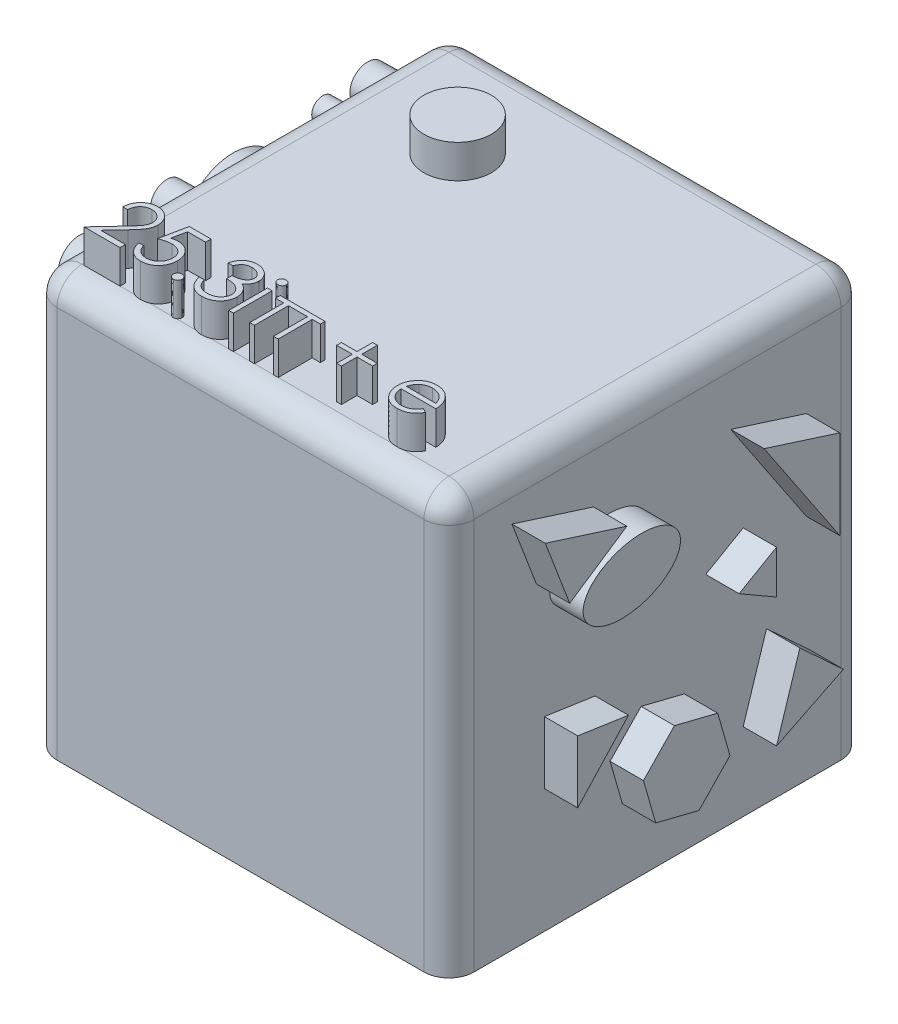
from build123d import *

# Parameters (mm, degrees)
SKETCH1_W            = 25
SKETCH1_H            = 25
BOSS_EXTRUDE1_DEPTH  = 25
FILLET1_R            = 1.5
SKETCH6_R            = 2.026123186
BOSS_EXTRUDE5_DEPTH  = 2
SKETCH7_R            = 3.595459334
SKETCH7_R_2          = 0.715535939
SKETCH7_R_3          = 2.059834248
SKETCH7_R_4          = 1.586063715
SKETCH7_R_5          = 2.397187079
SKETCH7_R_6          = 3.627701662
BOSS_EXTRUDE6_DEPTH  = 2
SKETCH8_R            = 1.764622128
SKETCH8_R_2          = 3.10645752
SKETCH8_R_3          = 0.547583735
SKETCH8_R_4          = 1.250736535
SKETCH8_R_5          = 1.052033482
SKETCH8_R_6          = 0.451602651
SKETCH8_R_7          = 1.617873899
SKETCH8_R_8          = 1.022441615
SKETCH8_R_9          = 0.77507926
SKETCH8_R_10         = 1.237307576
SKETCH8_R_11         = 1.5191319
SKETCH8_R_12         = 1.217510418
SKETCH8_R_13         = 1.369527197
SKETCH8_R_14         = 0.830021689
SKETCH8_R_15         = 1.879951284
SKETCH8_R_16         = 1.537232229
SKETCH8_R_17         = 1.151365365
SKETCH8_R_18         = 1.459956672
SKETCH8_R_19         = 1.790115864
SKETCH8_R_20         = 1.38656203
SKETCH8_R_21         = 1.341895942
SKETCH8_R_22         = 1.023270854
SKETCH8_R_23         = 1.246779248
SKETCH8_R_24         = 1.104587198
SKETCH8_R_25         = 0.55757663
SKETCH8_R_26         = 0.268564469
SKETCH8_R_27         = 0.690422027
SKETCH8_R_28         = 0.887930936
SKETCH8_R_29         = 1.067289644
SKETCH8_R_30         = 0.598454039
SKETCH8_R_31         = 1.309058838
SKETCH8_R_32         = 0.698196379
SKETCH8_R_33         = 0.775813334
SKETCH8_R_34         = 0.897681058
SKETCH8_R_35         = 0.98361322
SKETCH8_R_36         = 0.459674454
SKETCH8_R_37         = 0.884806863
SKETCH8_R_38         = 0.811843828
BOSS_EXTRUDE8_DEPTH  = 2
BOSS_EXTRUDE8_TAPER  = 1
SKETCH9_RX           = 2.964294683
SKETCH9_RY           = 1.852579298
BOSS_EXTRUDE9_DEPTH  = 2
BOSS_EXTRUDE10_DEPTH = 2
SKETCH11_W           = 0.284935898
SKETCH11_H           = 2.320192308
BOSS_EXTRUDE11_DEPTH = 2


with BuildPart() as part:
    # Sketch1 → Boss-Extrude1 (new body)
    with BuildSketch(Plane(origin=(0, 0, 0), x_dir=(1, 0, 0), z_dir=(0, 1, 0))):
        with Locations((12.5, -12.5)):
            Rectangle(SKETCH1_W, SKETCH1_H)
    extrude(amount=BOSS_EXTRUDE1_DEPTH)

    # Fillet1
    fillet1_edges = [part.edges().sort_by_distance(p)[0] for p in [
        (0, 12.5, 25),
        (0, 12.5, 0),
        (25, 12.5, 0),
        (25, 12.5, 25),
        (0, 25, 12.5),
        (12.5, 25, 0),
        (12.5, 25, 25),
        (25, 25, 12.5),
    ]]
    fillet(fillet1_edges, radius=FILLET1_R)

    # Sketch6 → Boss-Extrude5 (add)
    with BuildSketch(Plane(origin=(0, 25, 0), x_dir=(1, 0, 0), z_dir=(0, 1, 0))):
        with Locations((6.996974354, -6.4810657)):
            Circle(SKETCH6_R)
    extrude(amount=BOSS_EXTRUDE5_DEPTH)

    # Sketch7 → Boss-Extrude6 (add)
    with BuildSketch(Plane(origin=(0, 0, 0), x_dir=(-1, 0, 0), z_dir=(0, -1, 0))):
        with Locations((-5.965157046, -19.12082773)):
            Circle(SKETCH7_R)
        with Locations((-15.810413865, -15.079543271)):
            Circle(SKETCH7_R_2)
        with Locations((-16.525949804, -19.550751609)):
            Circle(SKETCH7_R_3)
        with Locations((-7.942806887, -9.361555686)):
            Circle(SKETCH7_R_4)
        with Locations((-17.143177889, -9.748487177)):
            Circle(SKETCH7_R_5)
        with Locations((-11.769129406, -4.890347349)):
            Circle(SKETCH7_R_6)
    extrude(amount=BOSS_EXTRUDE6_DEPTH)

    # Sketch8 → Boss-Extrude8 (add)
    with BuildSketch(Plane.ZY):
        with Locations((5.567907382, 18.58428273)):
            Circle(SKETCH8_R)
        with Locations((10.953993733, 19.681448468)):
            Circle(SKETCH8_R_2)
        with Locations((7.847536212, 13.647036908)):
            Circle(SKETCH8_R_3)
        with Locations((14.060451253, 14.694331476)):
            Circle(SKETCH8_R_4)
        with Locations((17.636730501, 19.132865599)):
            Circle(SKETCH8_R_5)
        with Locations((10.156055014, 9.657343315)):
            Circle(SKETCH8_R_6)
        with Locations((3.803285254, 11.053736072)):
            Circle(SKETCH8_R_7)
        with Locations((7.299952477, 11.402834262)):
            Circle(SKETCH8_R_8)
        with Locations((15.311187788, 10.108945966)):
            Circle(SKETCH8_R_9)
        with Locations((10.607657665, 13.099453173)):
            Circle(SKETCH8_R_10)
        with Locations((17.237761142, 13.443594941)):
            Circle(SKETCH8_R_11)
        with Locations((5.867134401, 7.163784819)):
            Circle(SKETCH8_R_12)
        with Locations((10.607657665, 6.71494429)):
            Circle(SKETCH8_R_13)
        with Locations((15.741626045, 7.163784819)):
            Circle(SKETCH8_R_14)
        with Locations((3.803285254, 2.874864206)):
            Circle(SKETCH8_R_15)
        with Locations((9.238130468, 2.874864206)):
            Circle(SKETCH8_R_16)
        with Locations((14.911604356, 3.672802925)):
            Circle(SKETCH8_R_17)
        with Locations((19.232607939, 4.82416829)):
            Circle(SKETCH8_R_18)
        with Locations((19.731319638, 10.108945966)):
            Circle(SKETCH8_R_19)
        with Locations((20.130288997, 16.988405292)):
            Circle(SKETCH8_R_20)
        with Locations((20.130288997, 21.776037604)):
            Circle(SKETCH8_R_21)
        with Locations((14.911604356, 22.374491643)):
            Circle(SKETCH8_R_22)
        with Locations((2.874864206, 15.542141365)):
            Circle(SKETCH8_R_23)
        with Locations((2.874864206, 22.374491643)):
            Circle(SKETCH8_R_24)
        with Locations((6.266103761, 16.090724234)):
            Circle(SKETCH8_R_25)
        with Locations((4.769968663, 14.295362117)):
            Circle(SKETCH8_R_26)
        with Locations((9.238130468, 16.090724234)):
            Circle(SKETCH8_R_27)
        with Locations((2.326281337, 7.861981198)):
            Circle(SKETCH8_R_28)
        with Locations((17.237761142, 2.326281337)):
            Circle(SKETCH8_R_29)
        with Locations((20.130288997, 2.326281337)):
            Circle(SKETCH8_R_30)
        with Locations((21.127712395, 7.163784819)):
            Circle(SKETCH8_R_14)
        with Locations((12.30051532, 10.654766713)):
            Circle(SKETCH8_R_31)
        with Locations((5.567907382, 22.374491643)):
            Circle(SKETCH8_R_32)
        with Locations((2.326281337, 19.132865599)):
            Circle(SKETCH8_R_33)
        with Locations((21.127712395, 13.443594941)):
            Circle(SKETCH8_R_34)
        with Locations((15.741626045, 16.988405292)):
            Circle(SKETCH8_R_35)
        with Locations((14.911604356, 19.908678932)):
            Circle(SKETCH8_R_36)
        with Locations((13.297938719, 7.163784819)):
            Circle(SKETCH8_R_37)
        with Locations((12.30051532, 1.927311978)):
            Circle(SKETCH8_R_38)
    extrude(amount=BOSS_EXTRUDE8_DEPTH, taper=BOSS_EXTRUDE8_TAPER)

    # Sketch9 → Boss-Extrude9 (add)
    with BuildSketch(Plane(origin=(25, 0, 0), x_dir=(0, 0, -1), z_dir=(1, 0, 0))):
        with Locations(Location((-16.040853064, 17.836215181), (0, 0, -167.366638065))):
            Ellipse(SKETCH9_RX, SKETCH9_RY)
        Polygon((-10.156055014, 5.567907382), (-10.891239331, 8.137934389), (-13.484540167, 8.786259598), (-15.342656685, 6.8645578), (-14.607472368, 4.294530792), (-12.014171533, 3.646205583), align=None)
    extrude(amount=BOSS_EXTRUDE9_DEPTH)

    # Sketch10 → Boss-Extrude10 (add)
    with BuildSketch(Plane(origin=(25, 0, 0), x_dir=(0, 0, -1), z_dir=(1, 0, 0))):
        Polygon((-19.282479109, 7.413140669), (-19.282479109, 11.153478412), (-16.240337744, 10.704637883), align=None)
        Polygon((-9.607472145, 13.696908078), (-7.363269499, 12.401217076), (-7.363269499, 14.99259908), align=None)
        Polygon((-8.111337047, 20.479387187), (-3.573060585, 19.033123259), (-3.573060585, 13.696908078), align=None)
        Polygon((-7.363269499, 4.670226323), (-5.964684602, 9.058889276), (-3.355326895, 6.647210183), align=None)
        Polygon((-21.227454735, 22.125135794), (-16.339359303, 20.567391095), (-19.761296972, 18.277712214), align=None)
    extrude(amount=BOSS_EXTRUDE10_DEPTH)

    # Sketch11 → Boss-Extrude11 (add)
    # profile 1 of 9: a face of its own
    with BuildSketch(Plane(origin=(0, 25, 0), x_dir=(1, 0, 0), z_dir=(0, 1, 0))):
        with BuildLine():
            Line((2.029166667, -21.301923077), (1.744230769, -21.301923077))
            add(Edge.make_bspline(
                [(1.744230769, -21.301923077), (1.746087829, -21.264121629), (1.749735046, -21.189880591), (1.766814994, -21.081636761), (1.791254219, -20.978172765), (1.825808609, -20.880319343), (1.868722161, -20.787211282), (1.9201844, -20.699218411), (1.981138822, -20.616676404), (2.050269216, -20.540350453), (2.125352196, -20.4703303), (2.206365441, -20.409864472), (2.291496287, -20.358776299), (2.380486456, -20.316066887), (2.474339968, -20.284008598), (2.572205131, -20.260221825), (2.674511919, -20.245910426), (2.744216797, -20.244372106), (2.779667468, -20.243589744)],
                knots=[0, 0, 0, 0, 1.10065271, 2.161652631, 3.183658789, 4.190468796, 5.17591951, 6.163126047, 7.15150782, 8.156236427, 9.156009102, 10.134482811, 11.092018607, 12.041330605, 13.001268258, 13.972401359, 14.968799086, 16, 16, 16, 16], degree=3))
            add(Edge.make_bspline(
                [(2.779667468, -20.243589744), (2.814481864, -20.244404772), (2.882890908, -20.246006274), (2.982732878, -20.259759493), (3.077780852, -20.281300137), (3.167849041, -20.311521979), (3.252218828, -20.352147852), (3.331524018, -20.400949905), (3.406708754, -20.457392181), (3.474387764, -20.523843854), (3.536534379, -20.594784589), (3.590148568, -20.670520044), (3.636061937, -20.748742325), (3.67433219, -20.830047908), (3.702504545, -20.915202341), (3.723893348, -21.002965875), (3.735983216, -21.094246953), (3.737838707, -21.156029329), (3.738782051, -21.187439904)],
                knots=[0, 0, 0, 0, 1.111607364, 2.184268762, 3.212621178, 4.221274766, 5.211760367, 6.196651075, 7.1921475, 8.207485113, 9.220403448, 10.201281604, 11.166441695, 12.114753415, 13.065576456, 14.026450734, 14.996634279, 16, 16, 16, 16], degree=3))
            add(Edge.make_bspline(
                [(3.738782051, -21.187439904), (3.73724602, -21.231661154), (3.734200913, -21.319327633), (3.708152871, -21.448155402), (3.667470679, -21.572972289), (3.618487362, -21.673426842), (3.569073074, -21.754374368), (3.524543692, -21.821020979), (3.472414899, -21.89278094), (3.411927976, -21.969413953), (3.344334156, -22.051520274), (3.269021194, -22.139050303), (3.185452035, -22.231099694), (3.126797538, -22.293969775), (3.096404247, -22.326547476)],
                knots=[0, 0, 0, 0, 1.184426356, 2.348067706, 3.509069118, 4.696110526, 5.333549288, 6.050745305, 6.844228056, 7.710549037, 8.667450064, 9.695053472, 10.805634456, 12, 12, 12, 12], degree=3))
            Line((3.096404247, -22.326547476), (2.302018229, -23.174358974))
            Line((2.302018229, -23.174358974), (3.779487179, -23.174358974))
            Line((3.779487179, -23.174358974), (3.779487179, -23.5))
            Line((3.779487179, -23.5), (1.622115385, -23.5))
            Line((1.622115385, -23.5), (2.853445513, -22.18598758))
            add(Edge.make_bspline(
                [(2.853445513, -22.18598758), (2.883424667, -22.154692688), (2.941008488, -22.094581604), (3.022454111, -22.006821919), (3.095605193, -21.925406264), (3.160935257, -21.850488467), (3.217027079, -21.780972687), (3.266804033, -21.719110349), (3.306687104, -21.662183098), (3.349971785, -21.596196969), (3.391894468, -21.51563151), (3.427919248, -21.417175949), (3.449885575, -21.31582337), (3.452520676, -21.247332236), (3.453846154, -21.212880609)],
                knots=[0, 0, 0, 0, 1.329631726, 2.553950428, 3.673215718, 4.687767853, 5.603093632, 6.413772471, 7.123043292, 7.734684054, 8.834405432, 9.900288307, 10.943827018, 12, 12, 12, 12], degree=3))
            add(Edge.make_bspline(
                [(3.453846154, -21.212880609), (3.453269445, -21.191216769), (3.452132862, -21.1485215), (3.442101951, -21.085923419), (3.426943134, -21.025539624), (3.405221365, -20.967184376), (3.376549536, -20.911444392), (3.341648684, -20.858251821), (3.301380555, -20.806826831), (3.254797618, -20.758609196), (3.203624311, -20.714448388), (3.149563813, -20.675328682), (3.092368361, -20.64263606), (3.032279108, -20.615835888), (2.969463575, -20.594812506), (2.90380027, -20.580245081), (2.835470627, -20.571098827), (2.788813099, -20.569861329), (2.765039063, -20.569230769)],
                knots=[0, 0, 0, 0, 0.991446411, 1.95395049, 2.89581595, 3.838931463, 4.798493298, 5.75982156, 6.748411868, 7.785213223, 8.824556874, 9.840280684, 10.836137867, 11.835679398, 12.848801643, 13.863922112, 14.911575587, 16, 16, 16, 16], degree=3))
            add(Edge.make_bspline(
                [(2.765039063, -20.569230769), (2.740209807, -20.569879406), (2.691449249, -20.57115322), (2.619858412, -20.58006378), (2.551563457, -20.595436078), (2.486392588, -20.616460633), (2.424235535, -20.643183745), (2.365394581, -20.676468399), (2.310001817, -20.716186282), (2.257953113, -20.761217358), (2.209997932, -20.811352968), (2.167863981, -20.867242006), (2.131048482, -20.927864018), (2.098927249, -20.993055432), (2.07284173, -21.063407789), (2.052908944, -21.13867135), (2.03713659, -21.218519318), (2.031867432, -21.273660073), (2.029166667, -21.301923077)],
                knots=[0, 0, 0, 0, 1.031018746, 2.02475058, 2.990194455, 3.934040569, 4.864654155, 5.795059489, 6.735614925, 7.690564532, 8.649604399, 9.611025574, 10.590972636, 11.591080095, 12.624614302, 13.701020113, 14.821632451, 16, 16, 16, 16], degree=3))
        make_face()
    # profile 2 of 9: a face of its own
    with BuildSketch(Plane(origin=(0, 25, 0), x_dir=(1, 0, 0), z_dir=(0, 1, 0))):
        with BuildLine():
            Line((6.058974359, -20.325), (6.058974359, -20.650641026))
            Line((6.058974359, -20.650641026), (4.979016426, -20.650641026))
            Line((4.979016426, -20.650641026), (4.807927684, -21.485732171))
            add(Edge.make_bspline(
                [(4.807927684, -21.485732171), (4.841542656, -21.476451853), (4.906666347, -21.458472705), (5.002787078, -21.438510328), (5.094038577, -21.426476675), (5.153252663, -21.424833557), (5.18190605, -21.424038462)],
                knots=[0, 0, 0, 0, 1.100273476, 2.13160584, 3.095893838, 4, 4, 4, 4], degree=3))
            add(Edge.make_bspline(
                [(5.18190605, -21.424038462), (5.217360585, -21.424805846), (5.28707306, -21.426314716), (5.389071247, -21.440803465), (5.486437515, -21.463608959), (5.578968236, -21.495468289), (5.666834593, -21.536207833), (5.749228167, -21.587098493), (5.827385702, -21.646546586), (5.899905055, -21.714895276), (5.965694963, -21.790117028), (6.023539825, -21.870995954), (6.072673032, -21.956746048), (6.11218886, -22.0481866), (6.14374322, -22.144306689), (6.164745387, -22.246117675), (6.178730544, -22.352659898), (6.180292995, -22.425507615), (6.181089744, -22.462655248)],
                knots=[0, 0, 0, 0, 1.052922333, 2.070308379, 3.05430497, 4.020497103, 4.973039431, 5.925935799, 6.892292201, 7.88610001, 8.88166317, 9.857072816, 10.836096531, 11.812156883, 12.81219415, 13.836441305, 14.89672472, 16, 16, 16, 16], degree=3))
            add(Edge.make_bspline(
                [(6.181089744, -22.462655248), (6.180486425, -22.488528977), (6.179287942, -22.539926773), (6.173193223, -22.616257583), (6.161458681, -22.690972439), (6.145703674, -22.764081252), (6.125254481, -22.835445611), (6.10049941, -22.905269782), (6.070204442, -22.973119176), (6.036974552, -23.039635784), (5.999558104, -23.103315858), (5.958030458, -23.162868868), (5.914156048, -23.21918818), (5.866947077, -23.271669781), (5.815964746, -23.319968804), (5.76182649, -23.364371888), (5.704964309, -23.405629952), (5.644498482, -23.442068243), (5.581776373, -23.475598925), (5.515892204, -23.503106705), (5.448345712, -23.527699827), (5.378164718, -23.547302756), (5.305508188, -23.562663002), (5.230256356, -23.573095689), (5.152803891, -23.580694315), (5.100302986, -23.581169982), (5.073783053, -23.581410256)],
                knots=[0, 0, 0, 0, 1.056347294, 2.098418968, 3.122841568, 4.141288669, 5.149314143, 6.15115421, 7.162517403, 8.180376062, 9.185164535, 10.17417709, 11.141909838, 12.097768115, 13.052685741, 14.0056014, 14.954263652, 15.917497458, 16.885230207, 17.854509472, 18.828990115, 19.81800267, 20.826176721, 21.857883937, 22.917946725, 24, 24, 24, 24], degree=3))
            add(Edge.make_bspline(
                [(5.073783053, -23.581410256), (5.042147189, -23.580783568), (4.979907364, -23.579550632), (4.88872085, -23.566652434), (4.800986886, -23.548179453), (4.717411723, -23.52038798), (4.637246362, -23.485565219), (4.561570039, -23.441554121), (4.488449085, -23.39168022), (4.420856024, -23.332824471), (4.358121549, -23.268493817), (4.301963502, -23.198682242), (4.251949471, -23.124541962), (4.208880372, -23.045712923), (4.172142882, -22.962402255), (4.143282142, -22.874297819), (4.119988206, -22.781859958), (4.110133532, -22.718220702), (4.105128205, -22.685897436)],
                knots=[0, 0, 0, 0, 1.0467383, 2.05933395, 3.04377827, 4.011590433, 4.970194871, 5.932262533, 6.905835911, 7.896367577, 8.894135286, 9.877477877, 10.858688626, 11.851381753, 12.8477658, 13.868841284, 14.917554742, 16, 16, 16, 16], degree=3))
            Line((4.105128205, -22.685897436), (4.390064103, -22.685897436))
            add(Edge.make_bspline(
                [(4.390064103, -22.685897436), (4.397075008, -22.716174646), (4.410550358, -22.774369126), (4.44012843, -22.856131128), (4.476292474, -22.928992139), (4.51929499, -22.993915975), (4.570593947, -23.050529851), (4.629131357, -23.100982471), (4.694761078, -23.146498482), (4.767689221, -23.184437706), (4.844626801, -23.216794361), (4.925151341, -23.238340541), (5.007070284, -23.253490637), (5.062477091, -23.255007163), (5.090319511, -23.255769231)],
                knots=[0, 0, 0, 0, 1.136247022, 2.183929868, 3.172523383, 4.106158343, 5.02341133, 5.958108904, 6.928429099, 7.938127109, 8.96079061, 9.975095812, 10.982467395, 12, 12, 12, 12], degree=3))
            add(Edge.make_bspline(
                [(5.090319511, -23.255769231), (5.1174961, -23.255024668), (5.171007026, -23.253558618), (5.249757355, -23.242274657), (5.325787605, -23.224896003), (5.398347565, -23.198888349), (5.468706961, -23.167279211), (5.535086025, -23.12671625), (5.599405063, -23.080034661), (5.65966487, -23.026552576), (5.714854942, -22.967615781), (5.763619423, -22.90458986), (5.80423848, -22.837355292), (5.838468708, -22.767076075), (5.864461343, -22.692981955), (5.883004233, -22.615420175), (5.893892722, -22.534199157), (5.895390578, -22.478800569), (5.896153846, -22.450570913)],
                knots=[0, 0, 0, 0, 1.027316725, 2.022795036, 3.002884548, 3.971462791, 4.93288096, 5.914575861, 6.907176829, 7.935150275, 8.956128384, 9.956726525, 10.942570165, 11.921478529, 12.907843606, 13.90538589, 14.932640048, 16, 16, 16, 16], degree=3))
            add(Edge.make_bspline(
                [(5.896153846, -22.450570913), (5.895556511, -22.425102196), (5.894387313, -22.375250805), (5.884834581, -22.302317239), (5.868218471, -22.233308122), (5.84515538, -22.16789021), (5.815873255, -22.106001802), (5.780089814, -22.047579026), (5.737133518, -21.993391906), (5.688064447, -21.943415089), (5.634308939, -21.897291524), (5.574942115, -21.857972246), (5.511206324, -21.824894263), (5.443869473, -21.796348293), (5.371329887, -21.775846188), (5.295024085, -21.760453892), (5.214128071, -21.751549956), (5.158818947, -21.750314529), (5.130388622, -21.749679487)],
                knots=[0, 0, 0, 0, 1.045622112, 2.046656509, 3.013763289, 3.955457236, 4.890082067, 5.820317437, 6.762574623, 7.722996705, 8.69280354, 9.665887285, 10.63943826, 11.638615906, 12.663482002, 13.728887084, 14.832589034, 16, 16, 16, 16], degree=3))
            add(Edge.make_bspline(
                [(5.130388622, -21.749679487), (5.105778808, -21.750206166), (5.054965785, -21.751293625), (4.977021507, -21.759300519), (4.895114015, -21.772217593), (4.809557294, -21.789985117), (4.720094405, -21.813236166), (4.626914141, -21.841098605), (4.529820585, -21.874410704), (4.464399507, -21.899567784), (4.430769231, -21.9125)],
                knots=[0, 0, 0, 0, 0.817624296, 1.688186739, 2.600797293, 3.572016777, 4.590301741, 5.671205678, 6.80286297, 8, 8, 8, 8], degree=3))
            Line((4.430769231, -21.9125), (4.756410256, -20.325))
            Line((4.756410256, -20.325), (6.058974359, -20.325))
        make_face()
    # profile 3 of 9: a face of its own
    with BuildSketch(Plane(origin=(0, 25, 0), x_dir=(1, 0, 0), z_dir=(0, 1, 0))):
        with BuildLine():
            add(Edge.make_bspline(
                [(7.015544872, -23.011538462), (7.033225279, -23.012589084), (7.067885649, -23.014648707), (7.11799543, -23.028778975), (7.163347728, -23.053869332), (7.203744836, -23.087309138), (7.237042854, -23.127854489), (7.263027373, -23.172845064), (7.277034553, -23.223374365), (7.279079173, -23.258235571), (7.280128205, -23.276121795)],
                knots=[0, 0, 0, 0, 1.020151414, 1.999887582, 2.974338812, 3.990962822, 5.007586832, 5.987933904, 6.967670073, 8, 8, 8, 8], degree=3))
            add(Edge.make_bspline(
                [(7.280128205, -23.276121795), (7.279043624, -23.293578244), (7.276904847, -23.328002105), (7.263059481, -23.378150289), (7.236844821, -23.423168981), (7.203974506, -23.464264492), (7.163337742, -23.497775139), (7.11788821, -23.52265203), (7.068003283, -23.537794041), (7.033244904, -23.539722896), (7.015544872, -23.540705128)],
                knots=[0, 0, 0, 0, 1.009421747, 1.99056486, 2.972319754, 3.999869655, 5.017953583, 5.993804169, 6.978383603, 8, 8, 8, 8], degree=3))
            add(Edge.make_bspline(
                [(7.015544872, -23.540705128), (6.997832086, -23.539758436), (6.963252088, -23.537910246), (6.913553365, -23.522341129), (6.867827043, -23.498008419), (6.827198191, -23.464202008), (6.794052577, -23.423380449), (6.768992408, -23.377840248), (6.753942773, -23.328145659), (6.751963503, -23.293606518), (6.750961538, -23.276121795)],
                knots=[0, 0, 0, 0, 1.022052826, 1.995314843, 2.982371812, 4.00089066, 5.028879526, 6.005146991, 6.990147033, 8, 8, 8, 8], degree=3))
            add(Edge.make_bspline(
                [(6.750961538, -23.276121795), (6.751925014, -23.258206286), (6.753806082, -23.223228454), (6.769024003, -23.173154978), (6.793858138, -23.127645037), (6.827427318, -23.087370996), (6.867817215, -23.0536368), (6.913443058, -23.029085166), (6.963371784, -23.014534221), (6.997852228, -23.012554367), (7.015544872, -23.011538462)],
                knots=[0, 0, 0, 0, 1.032775665, 2.016367738, 2.991239715, 4.008302682, 5.025365648, 6.011011707, 6.979408107, 8, 8, 8, 8], degree=3))
        make_face()
    # profile 4 of 9: a face of its own
    with BuildSketch(Plane(origin=(0, 25, 0), x_dir=(1, 0, 0), z_dir=(0, 1, 0))):
        with BuildLine():
            Line((8.094230769, -21.057692308), (7.809294872, -21.057692308))
            add(Edge.make_bspline(
                [(7.809294872, -21.057692308), (7.81701425, -21.025731412), (7.832105003, -20.963250474), (7.863580659, -20.87398103), (7.897869983, -20.789504693), (7.939044385, -20.711403254), (7.983955898, -20.638107107), (8.035411509, -20.571278687), (8.091037258, -20.509218354), (8.152564176, -20.454142774), (8.217088033, -20.40427012), (8.28551801, -20.361747746), (8.356477349, -20.325167979), (8.430457691, -20.295032483), (8.50767929, -20.272330758), (8.58744402, -20.255859941), (8.669960909, -20.245163716), (8.725974795, -20.24411981), (8.754417067, -20.243589744)],
                knots=[0, 0, 0, 0, 1.162005537, 2.271625781, 3.343758855, 4.383309926, 5.390229558, 6.379919256, 7.361854164, 8.333198761, 9.295911338, 10.242430842, 11.177959212, 12.116337295, 13.062827104, 14.020064771, 14.994644689, 16, 16, 16, 16], degree=3))
            add(Edge.make_bspline(
                [(8.754417067, -20.243589744), (8.79585784, -20.244840902), (8.877835443, -20.247315929), (8.998270493, -20.269916882), (9.114409107, -20.305681109), (9.224980068, -20.355096562), (9.32768536, -20.416045053), (9.419067473, -20.488584493), (9.497887765, -20.571315288), (9.564013379, -20.662694114), (9.615788556, -20.76035304), (9.653966909, -20.860864611), (9.677209434, -20.9639904), (9.680221654, -21.033620217), (9.681730769, -21.068504607)],
                knots=[0, 0, 0, 0, 1.083050992, 2.142477498, 3.193116406, 4.255571735, 5.30263384, 6.308962982, 7.297363603, 8.282367274, 9.249857812, 10.179914175, 11.08814088, 12, 12, 12, 12], degree=3))
            add(Edge.make_bspline(
                [(9.681730769, -21.068504607), (9.680675226, -21.102075057), (9.678609691, -21.167767217), (9.661071259, -21.263671718), (9.63155622, -21.354060884), (9.590671507, -21.439315224), (9.537747386, -21.518894186), (9.473637154, -21.592976815), (9.397888311, -21.661891694), (9.340485274, -21.701370073), (9.310932492, -21.721694712)],
                knots=[0, 0, 0, 0, 1.024540389, 2.004866551, 2.965041327, 3.920577974, 4.882998113, 5.874504559, 6.905732034, 8, 8, 8, 8], degree=3))
            add(Edge.make_bspline(
                [(9.310932492, -21.721694712), (9.344707012, -21.738003481), (9.411624105, -21.770315872), (9.5028378, -21.833685023), (9.585639873, -21.906851852), (9.631816818, -21.96394983), (9.655018029, -21.992638221)],
                knots=[0, 0, 0, 0, 1.015518401, 2.012035669, 3.001164323, 4, 4, 4, 4], degree=3))
            add(Edge.make_bspline(
                [(9.655018029, -21.992638221), (9.670295532, -22.013554896), (9.700600359, -22.05504572), (9.738006879, -22.121753764), (9.77194229, -22.189201186), (9.798385703, -22.25919579), (9.818863425, -22.33092631), (9.833501112, -22.404515912), (9.84259444, -22.480024689), (9.84389669, -22.531108153), (9.844551282, -22.556785857)],
                knots=[0, 0, 0, 0, 1.025084078, 2.033381695, 3.024893161, 4.013698104, 4.991890475, 5.976764909, 6.982997093, 8, 8, 8, 8], degree=3))
            add(Edge.make_bspline(
                [(9.844551282, -22.556785857), (9.842923402, -22.601244676), (9.839675303, -22.689953089), (9.810643035, -22.821012301), (9.765636738, -22.949124006), (9.701722232, -23.071656182), (9.623828135, -23.186301242), (9.531156848, -23.288877608), (9.42476132, -23.377050628), (9.30610191, -23.450719906), (9.177544229, -23.509609735), (9.040043514, -23.550483273), (8.895580965, -23.577104287), (8.796514345, -23.579958946), (8.746148838, -23.581410256)],
                knots=[0, 0, 0, 0, 0.955779014, 1.907060117, 2.875433937, 3.871313158, 4.872415639, 5.851225146, 6.836215519, 7.83643374, 8.849228613, 9.86973379, 10.916971861, 12, 12, 12, 12], degree=3))
            add(Edge.make_bspline(
                [(8.746148838, -23.581410256), (8.712204187, -23.580622663), (8.645412433, -23.579072942), (8.547220117, -23.568478782), (8.453492575, -23.54912942), (8.364103083, -23.523091422), (8.278972229, -23.490078913), (8.19835979, -23.44896838), (8.121769815, -23.400607231), (8.049925053, -23.344424619), (7.982834066, -23.281576547), (7.922279809, -23.210947302), (7.867252711, -23.133842514), (7.819226175, -23.049366599), (7.776012653, -22.958611259), (7.740469929, -22.860414407), (7.709186591, -22.755653901), (7.694641949, -22.682649094), (7.687179487, -22.645192308)],
                knots=[0, 0, 0, 0, 1.048658725, 2.063410685, 3.046034179, 4.001477787, 4.936774919, 5.862367409, 6.792675028, 7.730719943, 8.675894397, 9.627829632, 10.600096036, 11.597688215, 12.626045268, 13.701542398, 14.82072376, 16, 16, 16, 16], degree=3))
            Line((7.687179487, -22.645192308), (7.972115385, -22.645192308))
            add(Edge.make_bspline(
                [(7.972115385, -22.645192308), (7.979538799, -22.669638913), (7.993977985, -22.717189683), (8.018556384, -22.785624817), (8.046558316, -22.848361051), (8.076597952, -22.905858597), (8.10814697, -22.958683705), (8.143448367, -23.005439544), (8.17988752, -23.048179763), (8.207355219, -23.072259518), (8.220798277, -23.084044471)],
                knots=[0, 0, 0, 0, 1.198163088, 2.33053128, 3.407730985, 4.417276592, 5.372219308, 6.28897303, 7.162600585, 8, 8, 8, 8], degree=3))
            add(Edge.make_bspline(
                [(8.220798277, -23.084044471), (8.238575172, -23.097749888), (8.274074087, -23.125118417), (8.331920983, -23.160044894), (8.392758415, -23.19030811), (8.457904584, -23.213425463), (8.525953697, -23.232999484), (8.598005664, -23.245808812), (8.673424811, -23.254597367), (8.724921282, -23.255372912), (8.751236979, -23.255769231)],
                knots=[0, 0, 0, 0, 0.946170439, 1.889420265, 2.845303464, 3.807233317, 4.801018734, 5.828864929, 6.890507805, 8, 8, 8, 8], degree=3))
            add(Edge.make_bspline(
                [(8.751236979, -23.255769231), (8.780949085, -23.255210517), (8.839048543, -23.254118), (8.923825452, -23.244070751), (9.004477208, -23.229438162), (9.080108362, -23.206838528), (9.151709608, -23.178915898), (9.218277247, -23.143856273), (9.280685143, -23.102722133), (9.338133961, -23.055968753), (9.389791671, -23.004786397), (9.435275373, -22.951253111), (9.47394203, -22.895594608), (9.505132847, -22.837502884), (9.529762275, -22.777218498), (9.546529178, -22.714572274), (9.558187339, -22.650076897), (9.559136765, -22.606235618), (9.559615385, -22.584134615)],
                knots=[0, 0, 0, 0, 1.217147791, 2.380027433, 3.494444702, 4.572153297, 5.609568379, 6.639424714, 7.649109417, 8.668170816, 9.669597737, 10.625200337, 11.543417969, 12.441394052, 13.322311151, 14.205496177, 15.095365482, 16, 16, 16, 16], degree=3))
            add(Edge.make_bspline(
                [(9.559615385, -22.584134615), (9.558227183, -22.554551472), (9.555457686, -22.495532388), (9.534313474, -22.408702874), (9.499534648, -22.325043064), (9.450846012, -22.245980312), (9.391577173, -22.172705029), (9.322303293, -22.107325899), (9.242449114, -22.053378031), (9.168952519, -22.016104749), (9.10385127, -21.990671117), (9.048138743, -21.973730256), (8.985766681, -21.959385012), (8.91748935, -21.94603888), (8.84279229, -21.934680228), (8.761756821, -21.925208009), (8.674366523, -21.917628794), (8.613868108, -21.914244157), (8.582692308, -21.9125)],
                knots=[0, 0, 0, 0, 1.07054697, 2.135767047, 3.216561865, 4.33974944, 5.486079747, 6.621378074, 7.775625952, 8.963672916, 9.598146892, 10.304877434, 11.070270905, 11.915000392, 12.823868403, 13.805723172, 14.86925407, 16, 16, 16, 16], degree=3))
            Line((8.582692308, -21.9125), (8.582692308, -21.586858974))
            add(Edge.make_bspline(
                [(8.582692308, -21.586858974), (8.621972651, -21.586192402), (8.698913194, -21.584886752), (8.811303027, -21.569095199), (8.918775246, -21.54725063), (9.018948077, -21.513790491), (9.110250838, -21.474928222), (9.189462191, -21.429705146), (9.255472389, -21.379436052), (9.307960647, -21.323345042), (9.347447876, -21.26318782), (9.376319328, -21.200489138), (9.393373909, -21.134699454), (9.395650536, -21.08980072), (9.396794872, -21.067232572)],
                knots=[0, 0, 0, 0, 1.321986639, 2.589447074, 3.816329219, 5.01088745, 6.139805852, 7.153945165, 8.075214402, 8.924034688, 9.728124013, 10.488707548, 11.240355623, 12, 12, 12, 12], degree=3))
            add(Edge.make_bspline(
                [(9.396794872, -21.067232572), (9.396418942, -21.050652046), (9.395671047, -21.017665876), (9.386239231, -20.96947385), (9.372065994, -20.922755134), (9.352580811, -20.877708406), (9.326500273, -20.834646087), (9.295289128, -20.793201044), (9.258125209, -20.753609901), (9.215538982, -20.71670704), (9.169808273, -20.681537803), (9.119688834, -20.651680433), (9.066691848, -20.626148841), (9.01075864, -20.605094507), (8.951707694, -20.589256438), (8.88981646, -20.577884639), (8.824966918, -20.570774766), (8.78072399, -20.569751132), (8.758233173, -20.569230769)],
                knots=[0, 0, 0, 0, 0.884392785, 1.759457502, 2.611959086, 3.489218968, 4.37281399, 5.2945488, 6.255912374, 7.266815255, 8.301784654, 9.332968512, 10.37626691, 11.440494194, 12.520033166, 13.637162961, 14.798855837, 16, 16, 16, 16], degree=3))
            add(Edge.make_bspline(
                [(8.758233173, -20.569230769), (8.722082017, -20.570492933), (8.651470401, -20.572958233), (8.549675441, -20.594550967), (8.455042902, -20.629002514), (8.382708541, -20.670126039), (8.329293634, -20.710721075), (8.29112384, -20.746174383), (8.253640234, -20.785574159), (8.219308799, -20.831347113), (8.184588834, -20.880393416), (8.152979839, -20.935206327), (8.122264261, -20.994356028), (8.103756234, -21.036171353), (8.094230769, -21.057692308)],
                knots=[0, 0, 0, 0, 1.472543308, 2.876219568, 4.221790263, 5.565193594, 6.249813518, 6.953379497, 7.687249741, 8.463570142, 9.283606569, 10.136032583, 11.040678096, 12, 12, 12, 12], degree=3))
        make_face()
    # profile 5 of 9: a face of its own
    with BuildSketch(Plane(origin=(0, 25, 0), x_dir=(1, 0, 0), z_dir=(0, 1, 0))):
        with BuildLine():
            add(Edge.make_bspline(
                [(10.433503606, -20.202884615), (10.451185014, -20.203704811), (10.485808606, -20.205310911), (10.535876785, -20.219064537), (10.581467074, -20.242377823), (10.621905446, -20.273655819), (10.656605372, -20.310439957), (10.680899302, -20.353312407), (10.696513404, -20.399629886), (10.698398951, -20.43193786), (10.699358974, -20.44838742)],
                knots=[0, 0, 0, 0, 1.055194115, 2.066272739, 3.074728998, 4.095836921, 5.109056067, 6.073838105, 7.019297344, 8, 8, 8, 8], degree=3))
            add(Edge.make_bspline(
                [(10.699358974, -20.44838742), (10.698377301, -20.46440997), (10.696436648, -20.496084654), (10.680911363, -20.541599161), (10.656398333, -20.583875904), (10.621927697, -20.620588619), (10.581461178, -20.651849325), (10.535878351, -20.675167195), (10.485808194, -20.688919605), (10.451184874, -20.690525873), (10.433503606, -20.691346154)],
                knots=[0, 0, 0, 0, 0.96129708, 1.900370562, 2.859976407, 3.87933698, 4.906634145, 5.921202961, 6.938410037, 8, 8, 8, 8], degree=3))
            add(Edge.make_bspline(
                [(10.433503606, -20.691346154), (10.416024528, -20.690557193), (10.382003786, -20.689021585), (10.332685293, -20.674897354), (10.287483735, -20.651841345), (10.246966496, -20.620793306), (10.213193392, -20.583650435), (10.18861134, -20.541624961), (10.17312191, -20.496078085), (10.171176426, -20.464407763), (10.170192308, -20.44838742)],
                knots=[0, 0, 0, 0, 1.054934014, 2.053291228, 3.073705704, 4.106921865, 5.123545215, 6.088680038, 7.033164197, 8, 8, 8, 8], degree=3))
            add(Edge.make_bspline(
                [(10.170192308, -20.44838742), (10.171154865, -20.431940149), (10.173045388, -20.399636672), (10.18862295, -20.353286178), (10.212988633, -20.310667244), (10.246988859, -20.273451255), (10.287477783, -20.242385753), (10.332686831, -20.219334363), (10.382003379, -20.205208934), (10.41602439, -20.203673491), (10.433503606, -20.202884615)],
                knots=[0, 0, 0, 0, 0.98631895, 1.937192651, 2.907499808, 3.917963147, 4.944918757, 5.95915025, 6.951458133, 8, 8, 8, 8], degree=3))
        make_face()
    # profile 6 of 9: a face of its own
    with BuildSketch(Plane(origin=(0, 25, 0), x_dir=(1, 0, 0), z_dir=(0, 1, 0))):
        with Locations((10.434775641, -22.339903846)):
            Rectangle(SKETCH11_W, SKETCH11_H)
    # profile 7 of 9: a face of its own
    with BuildSketch(Plane(origin=(0, 25, 0), x_dir=(1, 0, 0), z_dir=(0, 1, 0))):
        Polygon((13.75224359, -21.46474359), (13.263782051, -21.46474359), (13.263782051, -23.5), (12.978846154, -23.5), (12.978846154, -21.46474359), (11.839102564, -21.46474359), (11.839102564, -23.5), (11.554166667, -23.5), (11.554166667, -21.46474359), (11.065705128, -21.46474359), (11.065705128, -21.179807692), (13.75224359, -21.179807692), align=None)
    # profile 8 of 9: a face of its own
    with BuildSketch(Plane(origin=(0, 25, 0), x_dir=(1, 0, 0), z_dir=(0, 1, 0))):
        Polygon((16.275961538, -21.790384615), (16.275961538, -20.854166667), (16.560897436, -20.854166667), (16.560897436, -21.790384615), (17.497115385, -21.790384615), (17.497115385, -22.075320513), (16.560897436, -22.075320513), (16.560897436, -23.011538462), (16.275961538, -23.011538462), (16.275961538, -22.075320513), (15.33974359, -22.075320513), (15.33974359, -21.790384615), align=None)
    # profile 9 of 9: a face of its own
    with BuildSketch(Plane(origin=(0, 25, 0), x_dir=(1, 0, 0), z_dir=(0, 1, 0))):
        with BuildLine():
            Line((21.233082933, -22.767307692), (21.486217949, -22.900235377))
            add(Edge.make_bspline(
                [(21.486217949, -22.900235377), (21.46604618, -22.936016113), (21.426799907, -23.005631256), (21.3593078, -23.101273015), (21.288557848, -23.187313443), (21.211356392, -23.261453915), (21.130013183, -23.3260891), (21.044077132, -23.382638413), (20.953100847, -23.430824499), (20.857080025, -23.471421435), (20.75520829, -23.502635762), (20.647238771, -23.524683162), (20.532964629, -23.538311413), (20.454636309, -23.539894505), (20.414528245, -23.540705128)],
                knots=[0, 0, 0, 0, 1.120438281, 2.179929193, 3.190490725, 4.156257408, 5.095198341, 6.022838206, 6.959905092, 7.901321166, 8.864066838, 9.862729781, 10.905609505, 12, 12, 12, 12], degree=3))
            add(Edge.make_bspline(
                [(20.414528245, -23.540705128), (20.369949451, -23.539664476), (20.282989139, -23.537634466), (20.156406654, -23.520133445), (20.037226753, -23.491583519), (19.925456136, -23.451700492), (19.821368522, -23.399605705), (19.724757032, -23.336142461), (19.635113605, -23.261636773), (19.555263072, -23.175443285), (19.48337755, -23.083203224), (19.419944842, -22.9870861), (19.366915601, -22.887333746), (19.32377859, -22.7845812), (19.288939891, -22.679476096), (19.264658667, -22.571062122), (19.250661682, -22.459632699), (19.248516792, -22.384251545), (19.247435897, -22.346264022)],
                knots=[0, 0, 0, 0, 1.145258523, 2.234067595, 3.276747158, 4.290159414, 5.277019952, 6.260822364, 7.254936242, 8.264827045, 9.274100331, 10.257902744, 11.220704747, 12.172965371, 13.118907548, 14.062713208, 15.023725156, 16, 16, 16, 16], degree=3))
            add(Edge.make_bspline(
                [(19.247435897, -22.346264022), (19.24839669, -22.310617998), (19.250300854, -22.239972284), (19.262303068, -22.135409969), (19.28357402, -22.033784158), (19.312762542, -21.935010409), (19.350455458, -21.839254102), (19.396567543, -21.746456958), (19.451170628, -21.656717724), (19.493327982, -21.600109167), (19.514563301, -21.571594551)],
                knots=[0, 0, 0, 0, 1.024358464, 2.0301432, 3.019427413, 4.004406732, 4.986367066, 5.972626655, 6.978780325, 8, 8, 8, 8], degree=3))
            add(Edge.make_bspline(
                [(19.514563301, -21.571594551), (19.543326699, -21.537242076), (19.599942344, -21.469625326), (19.695697037, -21.380781273), (19.799383644, -21.306355848), (19.909702762, -21.24466366), (20.027936564, -21.197788281), (20.152495706, -21.162856402), (20.284798488, -21.143282064), (20.375245367, -21.140517243), (20.421524439, -21.139102564)],
                knots=[0, 0, 0, 0, 1.030682036, 2.02871468, 2.997146059, 3.962720338, 4.930598197, 5.918074684, 6.934738563, 8, 8, 8, 8], degree=3))
            add(Edge.make_bspline(
                [(20.421524439, -21.139102564), (20.46910191, -21.14033088), (20.562438061, -21.142740555), (20.698538628, -21.165080158), (20.827317278, -21.200506404), (20.948722479, -21.250538771), (21.062766538, -21.31509065), (21.168708169, -21.395047892), (21.268359184, -21.487955728), (21.326333394, -21.559405211), (21.355834335, -21.595763221)],
                knots=[0, 0, 0, 0, 1.056321875, 2.072262726, 3.055038591, 4.01806755, 4.982017516, 5.957941055, 6.960871419, 8, 8, 8, 8], degree=3))
            add(Edge.make_bspline(
                [(21.355834335, -21.595763221), (21.375906629, -21.623162184), (21.41591761, -21.677777735), (21.466034622, -21.766832999), (21.50953883, -21.860006181), (21.544312302, -21.958803379), (21.572469564, -22.062053998), (21.592841107, -22.170496164), (21.604787832, -22.284097583), (21.60713615, -22.361500958), (21.608333333, -22.400961538)],
                knots=[0, 0, 0, 0, 0.94817472, 1.890038105, 2.849395472, 3.817997239, 4.812318967, 5.836947057, 6.897266129, 8, 8, 8, 8], degree=3))
            Line((21.608333333, -22.400961538), (19.532371795, -22.400961538))
            add(Edge.make_bspline(
                [(19.532371795, -22.400961538), (19.533768438, -22.431532674), (19.53651488, -22.491649579), (19.549319331, -22.579615932), (19.569502147, -22.663411749), (19.597867654, -22.742408509), (19.632218292, -22.817637982), (19.674296764, -22.888542115), (19.724497645, -22.954797952), (19.780491672, -23.016998141), (19.842818823, -23.072388974), (19.908389601, -23.121965943), (19.978143049, -23.163518163), (20.051529168, -23.197245634), (20.128429287, -23.223649221), (20.208867636, -23.241672172), (20.292685927, -23.253743619), (20.349822986, -23.255085887), (20.378911258, -23.255769231)],
                knots=[0, 0, 0, 0, 1.094153842, 2.151609401, 3.174256925, 4.172055639, 5.149267565, 6.128595816, 7.11444997, 8.118368179, 9.117203808, 10.09244225, 11.054858984, 12.015122123, 12.976791628, 13.957293641, 14.960065497, 16, 16, 16, 16], degree=3))
            add(Edge.make_bspline(
                [(20.378911258, -23.255769231), (20.407351228, -23.255217637), (20.463781583, -23.254123168), (20.547820075, -23.243480649), (20.630496646, -23.226271898), (20.71146911, -23.202785979), (20.789094091, -23.174141263), (20.860981126, -23.139576528), (20.927093893, -23.101340686), (20.988885713, -23.057607624), (21.048821542, -23.004078769), (21.108277941, -22.93728065), (21.172028905, -22.858279821), (21.21193375, -22.798820539), (21.233082933, -22.767307692)],
                knots=[0, 0, 0, 0, 0.99110716, 1.966546729, 2.947904876, 3.932708344, 4.903319531, 5.828989031, 6.710028674, 7.56322171, 8.463672341, 9.504779593, 10.677557249, 12, 12, 12, 12], degree=3))
        make_face()
        with BuildLine():
            add(Edge.make_bspline(
                [(21.323397436, -22.116025641), (21.312968355, -22.078231463), (21.292895732, -22.005489835), (21.250952744, -21.904759885), (21.203716418, -21.81523586), (21.147816704, -21.737602908), (21.084481146, -21.668656864), (21.011324445, -21.608405718), (20.92928617, -21.554505602), (20.838790378, -21.509010121), (20.742958187, -21.47028432), (20.64262257, -21.444317251), (20.540244434, -21.426528595), (20.470998331, -21.424872053), (20.436152845, -21.424038462)],
                knots=[0, 0, 0, 0, 1.154881502, 2.222775134, 3.210006277, 4.132804581, 5.035138423, 5.962687519, 6.919655026, 7.923214229, 8.944639381, 9.960483929, 10.97369054, 12, 12, 12, 12], degree=3))
            add(Edge.make_bspline(
                [(20.436152845, -21.424038462), (20.407714425, -21.424593335), (20.351497649, -21.425690203), (20.268674538, -21.436095249), (20.189136525, -21.453294537), (20.112296728, -21.476848462), (20.039162083, -21.508243408), (19.968228258, -21.545058193), (19.901298899, -21.589999486), (19.859442152, -21.624252162), (19.838296274, -21.64155649)],
                knots=[0, 0, 0, 0, 1.04873581, 2.073130211, 3.073294108, 4.04793562, 5.032784715, 6.005352987, 6.992311501, 8, 8, 8, 8], degree=3))
            add(Edge.make_bspline(
                [(19.838296274, -21.64155649), (19.823153083, -21.655249191), (19.792506954, -21.68295988), (19.751558052, -21.730702089), (19.712350909, -21.782183863), (19.676669667, -21.839374797), (19.643942142, -21.901623647), (19.61331702, -21.968405359), (19.585752203, -22.040226698), (19.570243589, -22.090275983), (19.562264623, -22.116025641)],
                knots=[0, 0, 0, 0, 0.879870761, 1.780643979, 2.707998968, 3.669668524, 4.684282772, 5.740141944, 6.837334558, 8, 8, 8, 8], degree=3))
            Line((19.562264623, -22.116025641), (21.323397436, -22.116025641))
        make_face(mode=Mode.SUBTRACT)
    extrude(amount=BOSS_EXTRUDE11_DEPTH)


solid = part.part
